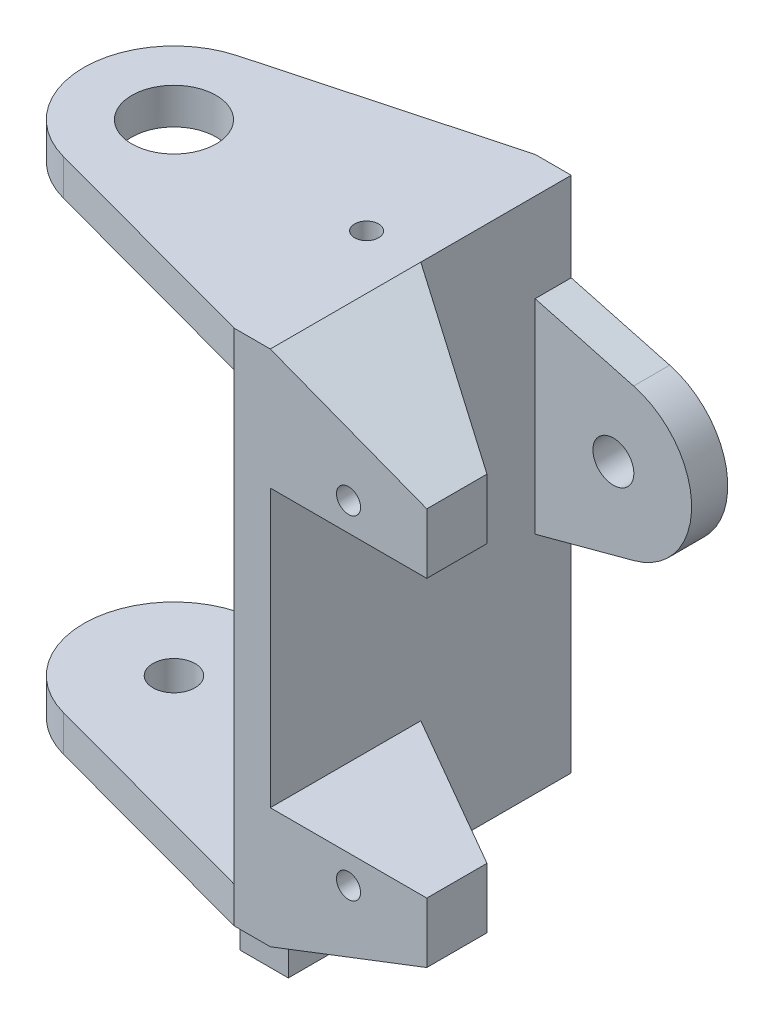
from build123d import *

# Parameters (mm, degrees)
ESBO_O1_R                  = 1
RESSALTO_EXTRUS_O1_DEPTH   = 12.5
ESBO_O2_R                  = 3.5
ESBO_O2_R_2                = 1
CORTE_EXTRUS_O1_DEPTH      = 15
CORTE_EXTRUS_O2_DEPTH      = 49.314076624
CORTE_EXTRUS_O2_DEPTH_BACK = 49.314076624
ESBO_O5_R                  = 1.7
RESSALTO_EXTRUS_O2_DEPTH   = 3
ESBO_O7_R                  = 1.75
CORTE_EXTRUS_O3_DEPTH      = 10
CORTE_EXTRUS_O4_DEPTH      = 56.625983137
RESSALTO_EXTRUS_O3_START   = -4
RESSALTO_EXTRUS_O3_DEPTH   = 4


with BuildPart() as part:
    # Esboço1 → Ressalto-extrusão1 (new, symmetric)
    with BuildSketch(Plane.XY):
        Polygon((0, -21.5), (-33, -21.5), (-33, -18.5), (-3, -18.5), (-3, 18.5), (-33, 18.5), (-33, 21.5), (0, 21.5), (13, 16.5), (13, 11.5), (0, 11.5), (0, -11.5), (13, -11.5), (13, -16.5), align=None)
        with Locations((6.5, 13.85)):
            Circle(ESBO_O1_R, mode=Mode.SUBTRACT)
        with Locations((6.5, -13.85)):
            Circle(ESBO_O1_R, mode=Mode.SUBTRACT)
    extrude(amount=RESSALTO_EXTRUS_O1_DEPTH, both=True)

    # Esboço2 → Corte-extrusão1 (cut)
    with BuildSketch(Plane(origin=(0, 21.5, 0), x_dir=(1, 0, 0), z_dir=(0, 1, 0))):
        with Locations((-20.5, 0)):
            Circle(ESBO_O2_R)
        with Locations((-4.5, 0)):
            Circle(ESBO_O2_R_2)
        with BuildLine():
            Line((-3, 12.5), (-22.45722521, 7.240115294))
            ThreePointArc((-22.45722521, 7.240115294), (-28, 0), (-22.45722521, -7.240115294))
            Line((-22.45722521, -7.240115294), (-3, -12.5))
            Line((-3, -12.5), (-33, -12.5))
            Line((-33, -12.5), (-33, 12.5))
            Line((-33, 12.5), (-3, 12.5))
        make_face()
    extrude(amount=-CORTE_EXTRUS_O1_DEPTH, mode=Mode.SUBTRACT)

    # Esboço4 → Corte-extrusão2 (cut, two sides: drawn at the far end of the back side and taken through both)
    with BuildSketch(Plane(origin=(0, -11.5, 0), x_dir=(1, 0, 0), z_dir=(0, 1, 0)).offset(-CORTE_EXTRUS_O2_DEPTH_BACK)):
        Polygon((13, -7.5), (0, 0.005553499), (0, 12.5), (13, 12.5), align=None)
    extrude(amount=CORTE_EXTRUS_O2_DEPTH + CORTE_EXTRUS_O2_DEPTH_BACK, mode=Mode.SUBTRACT)

    # Esboço5 → Ressalto-extrusão2 (add)
    with BuildSketch(Plane(origin=(0, 0, -12.5), x_dir=(-1, 0, 0), z_dir=(0, 0, -1))):
        with BuildLine():
            Line((-8.182323793, 11.928517871), (0, 14.120964923))
            Line((0, 14.120964923), (0, -2.820964923))
            Line((0, -2.820964923), (-8.182323793, -0.628517871))
            ThreePointArc((-8.182323793, -0.628517871), (-13, 5.65), (-8.182323793, 11.928517871))
        make_face()
        with Locations((-6.5, 5.65)):
            Circle(ESBO_O5_R, mode=Mode.SUBTRACT)
    extrude(amount=-RESSALTO_EXTRUS_O2_DEPTH)

    # Esboço7 → Corte-extrusão3 (cut)
    with BuildSketch(Plane(origin=(0, -18.5, 0), x_dir=(1, 0, 0), z_dir=(0, 1, 0))):
        with Locations((-20.5, 0)):
            Circle(ESBO_O7_R)
    extrude(amount=-CORTE_EXTRUS_O3_DEPTH, mode=Mode.SUBTRACT)

    # Esboço2<2> → Corte-extrusão4 (cut, through all)
    with BuildSketch(Plane(origin=(0, 21.5, 0), x_dir=(1, 0, 0), z_dir=(0, 1, 0))):
        with BuildLine():
            Line((-22.45722521, 7.240115294), (-3, 12.5))
            Line((-3, 12.5), (-33, 12.5))
            Line((-33, 12.5), (-33, -12.5))
            Line((-33, -12.5), (-3, -12.5))
            Line((-3, -12.5), (-22.45722521, -7.240115294))
            ThreePointArc((-22.45722521, -7.240115294), (-28, 0), (-22.45722521, 7.240115294))
        make_face()
    extrude(amount=-CORTE_EXTRUS_O4_DEPTH, mode=Mode.SUBTRACT)

    # Esboço8 → Ressalto-extrusão3 (add)
    with BuildSketch(Plane(origin=(0, 0, 0), x_dir=(0, 0, -1), z_dir=(1, 0, 0)).offset(RESSALTO_EXTRUS_O3_START)):
        Polygon((10, -21.5), (3, -28.5), (-7, -28.5), (-7, -25.5), (-5, -24), (-5, -25.5), (1.757359313, -25.5), (5.757359313, -21.5), align=None)
    extrude(amount=-RESSALTO_EXTRUS_O3_DEPTH)


solid = part.part
